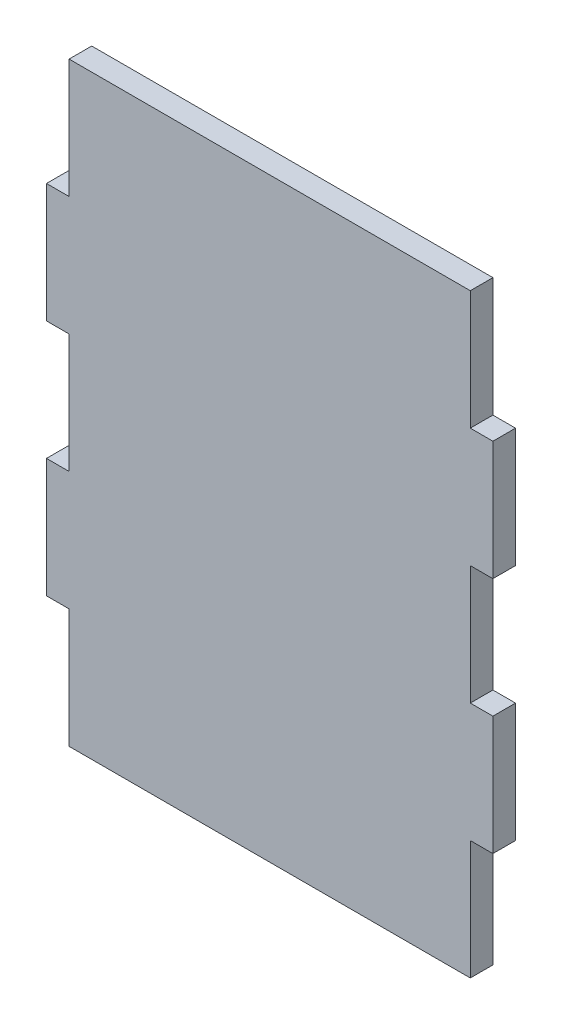
from build123d import *

# Parameters (mm, degrees)
BOSS_EXTRUDE1_DEPTH = 4.826


with BuildPart() as part:
    # Sketch1 → Boss-Extrude1 (new body)
    with BuildSketch(Plane.XY):
        Polygon((0, 76.2), (0, 101.6), (4.826, 101.6), (4.826, 127), (90.424, 127), (90.424, 101.6), (95.25, 101.6), (95.25, 76.2), (90.424, 76.2), (90.424, 50.8), (95.25, 50.8), (95.25, 25.4), (90.424, 25.4), (90.424, 0), (4.826, 0), (4.826, 25.4), (0, 25.4), (0, 50.8), (4.826, 50.8), (4.826, 76.2), align=None)
    extrude(amount=BOSS_EXTRUDE1_DEPTH)


solid = part.part
